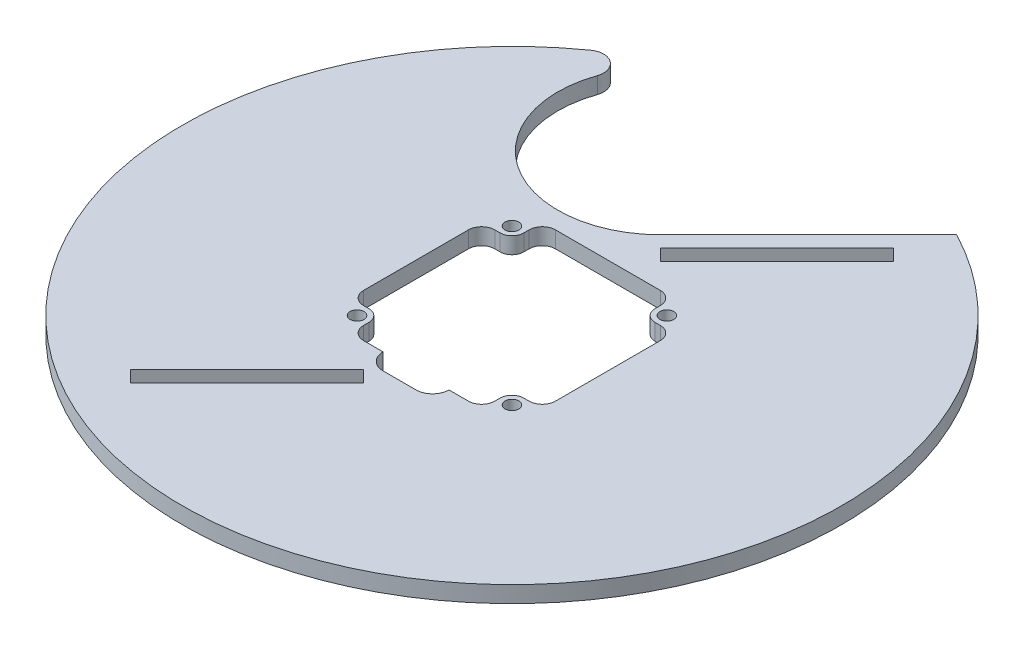
from build123d import *

# Parameters (mm, degrees)
EXTRUDE_1_DEPTH          = 5
CUT_EXTRUDE_1_DEPTH      = 142.509716981
CUT_EXTRUDE_1_DEPTH_BACK = 142.509716981
HOLE_WIZARD_M5_1_D       = 4.2


with BuildPart() as part:
    # 草圖1 → 填料-伸長1 (new body)
    with BuildSketch(Plane(origin=(0, 0, 0), x_dir=(1, 0, 0), z_dir=(0, 1, 0))):
        with BuildLine():
            Line((46.240484381, 88.666891252), (1.290175475, 43.716582347))
            ThreePointArc((1.290175475, 43.716582347), (-37.241511516, 39.366784953), (-50.07196053, 75.95901388))
            ThreePointArc((-50.07196053, 75.95901388), (-51.783240076, 81.599208584), (-57.67661441, 81.690930648))
            ThreePointArc((-57.67661441, 81.690930648), (6.697930583, -99.775436486), (46.240484381, 88.666891252))
        make_face()
        Polygon((-40.181048441, -75.5363875), (-43.716582347, -72.000853594), (-8.361243287, -36.645514535), (-4.825709381, -40.181048441), align=None, mode=Mode.SUBTRACT)
        with BuildLine():
            ThreePointArc((-23.499999452, 19.89891353), (-20.953647337, 20.953647337), (-19.89891353, 23.499999452))
            Line((-19.89891353, 23.499999452), (-19.898913286, 25.100000259))
            ThreePointArc((-19.898913286, 25.100000259), (-18.727340196, 27.92842699), (-15.898913286, 29.09999965))
            Line((-15.898913286, 29.09999965), (15.898913286, 29.09999965))
            ThreePointArc((15.898913286, 29.09999965), (18.727340196, 27.92842699), (19.898913286, 25.100000259))
            Line((19.898913286, 25.100000259), (19.89891353, 23.499999452))
            ThreePointArc((19.89891353, 23.499999452), (20.953647337, 20.953647337), (23.499999452, 19.89891353))
            Line((23.499999452, 19.89891353), (25.100000259, 19.898913286))
            ThreePointArc((25.100000259, 19.898913286), (27.92842699, 18.727340196), (29.09999965, 15.898913286))
            Line((29.09999965, 15.898913286), (29.09999965, -15.898913286))
            ThreePointArc((29.09999965, -15.898913286), (27.92842699, -18.727340196), (25.100000259, -19.898913286))
            Line((25.100000259, -19.898913286), (23.499999452, -19.89891353))
            ThreePointArc((23.499999452, -19.89891353), (20.953647337, -20.953647337), (19.89891353, -23.499999452))
            Line((19.89891353, -23.499999452), (19.898913286, -25.100000259))
            ThreePointArc((19.898913286, -25.100000259), (18.727340196, -27.92842699), (15.898913286, -29.09999965))
            Line((15.898913286, -29.09999965), (-15.898913286, -29.09999965))
            ThreePointArc((-15.898913286, -29.09999965), (-18.727340196, -27.92842699), (-19.898913286, -25.100000259))
            Line((-19.898913286, -25.100000259), (-19.89891353, -23.499999452))
            ThreePointArc((-19.89891353, -23.499999452), (-20.953647337, -20.953647337), (-23.499999452, -19.89891353))
            Line((-23.499999452, -19.89891353), (-25.100000259, -19.898913286))
            ThreePointArc((-25.100000259, -19.898913286), (-27.92842699, -18.727340196), (-29.09999965, -15.898913286))
            Line((-29.09999965, -15.898913286), (-29.09999965, 15.898913286))
            ThreePointArc((-29.09999965, 15.898913286), (-27.92842699, 18.727340196), (-25.100000259, 19.898913286))
            Line((-25.100000259, 19.898913286), (-23.499999452, 19.89891353))
        make_face(mode=Mode.SUBTRACT)
        Polygon((43.716582347, 72.000853594), (8.361243287, 36.645514535), (4.825709381, 40.181048441), (40.181048441, 75.5363875), align=None, mode=Mode.SUBTRACT)
    extrude(amount=-EXTRUDE_1_DEPTH)

    # 草圖5 → 除料-伸長1 (cut, two sides: drawn at the far end of the back side and taken through both)
    with BuildSketch(Plane(origin=(0, 0, 0), x_dir=(1, 0, 0), z_dir=(0, 1, 0)).offset(-CUT_EXTRUDE_1_DEPTH_BACK)):
        with BuildLine():
            Line((-5, -24.09999965), (5, -24.09999965))
            ThreePointArc((5, -24.09999965), (10, -29.09999965), (5, -34.09999965))
            Line((5, -34.09999965), (-5, -34.09999965))
            ThreePointArc((-5, -34.09999965), (-10, -29.09999965), (-5, -24.09999965))
        make_face()
    extrude(amount=CUT_EXTRUDE_1_DEPTH + CUT_EXTRUDE_1_DEPTH_BACK, mode=Mode.SUBTRACT)

    # M5 螺紋孔1 (through all)
    with Locations(Plane(origin=(0, 0, 0), x_dir=(1, 0, 0), z_dir=(0, 1, 0))):
        with Locations((23.5, 23.5), (23.5, -23.5), (-23.5, -23.5), (-23.5, 23.5)):
            Hole(HOLE_WIZARD_M5_1_D / 2)


solid = part.part
